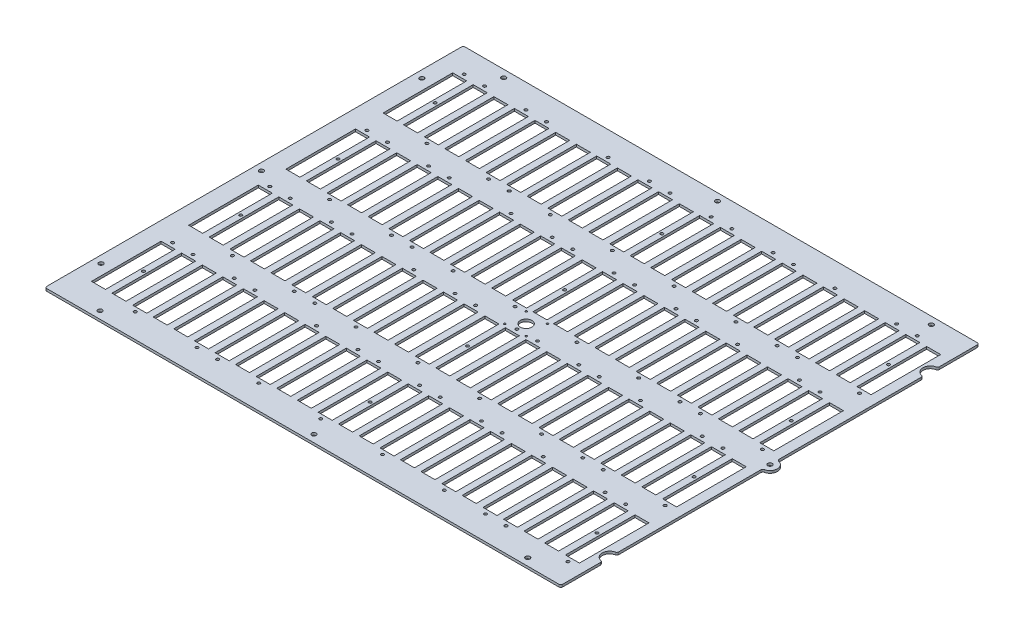
from build123d import *

# Parameters (mm, degrees)
BOSS_EXTRUDE1_DEPTH        = 3.175
SKETCH2_R                  = 1.905
SKETCH2_W                  = 18.288
SKETCH2_H                  = 90.932
CUT_EXTRUDE1_DEPTH         = 3.175
F_1_0_228_DIAMETER_HOLE1_D = 5.7912
FILLET1_R                  = 2.54
CUT_EXTRUDE3_OUTLINE_W     = 18.288
CUT_EXTRUDE3_OUTLINE_H     = 90.932
CUT_EXTRUDE3_OUTLINE_R     = 1.89865
CUT_EXTRUDE3_OUTLINE_R_2   = 2.8956
CUT_EXTRUDE3_OUTLINE_R_3   = 1.905
CUT_EXTRUDE3_DEPTH         = 3.175
CUT_EXTRUDE4_OUTLINE_R     = 1.2192
CUT_EXTRUDE4_OUTLINE_R_2   = 7.62
CUT_EXTRUDE4_DEPTH         = 3.175


# Read off the part's stored shape, not the designer's step: Cut-Extrude3, Cut-Extrude4
with BuildPart() as part:
    # Sketch1 → Boss-Extrude1 (new body)
    with BuildSketch(Plane(origin=(0, 0, 0), x_dir=(1, 0, 0), z_dir=(0, 1, 0))):
        with BuildLine():
            Line((337.058, 219.202), (337.058, 273.304))
            Line((337.058, 273.304), (-337.058, 273.304))
            Line((-337.058, 273.304), (-337.058, -273.304))
            Line((-337.058, -273.304), (337.058, -273.304))
            Line((337.058, -273.304), (337.058, -219.202))
            ThreePointArc((337.058, -219.202), (327.406, -209.55), (337.058, -199.898))
            Line((337.058, -199.898), (337.058, -9.652))
            ThreePointArc((337.058, -9.652), (346.71, 0), (337.058, 9.652))
            Line((337.058, 9.652), (337.058, 199.898))
            ThreePointArc((337.058, 199.898), (327.406, 209.55), (337.058, 219.202))
        make_face()
    extrude(amount=BOSS_EXTRUDE1_DEPTH)

    # Sketch2 → Cut-Extrude1 (cut)
    with BuildSketch(Plane(origin=(0, 3.175, 0), x_dir=(1, 0, 0), z_dir=(0, 1, 0))):
        with Locations(Location((-304.313166667, 241.808, 0), (0, 0, 270))):
            Circle(SKETCH2_R)
        with Locations(Location((-250.465166667, 139.192, 0), (0, 0, 270))):
            Circle(SKETCH2_R)
        with Locations(Location((-169.693166667, 139.192, 0), (0, 0, 270))):
            Circle(SKETCH2_R)
        with Locations(Location((-169.693166667, 12.192, 0), (0, 0, 270))):
            Circle(SKETCH2_R)
        with Locations(Location((-196.7865, 241.808, 0), (0, 0, 270))):
            Circle(SKETCH2_R)
        with Locations(Location((-169.693166667, -114.808, 0), (0, 0, 270))):
            Circle(SKETCH2_R)
        with Locations(Location((-169.693166667, -241.808, 0), (0, 0, 270))):
            Circle(SKETCH2_R)
        with Locations(Location((-116.1415, 241.808, 0), (0, 0, 270))):
            Circle(SKETCH2_R)
        with Locations(Location((-250.465166667, 12.192, 0), (0, 0, 270))):
            Circle(SKETCH2_R)
        with Locations(Location((-250.465166667, -114.808, 0), (0, 0, 270))):
            Circle(SKETCH2_R)
        with Locations(Location((-250.465166667, -241.808, 0), (0, 0, 270))):
            Circle(SKETCH2_R)
        with Locations(Location((-277.5585, 241.808, 0), (0, 0, 270))):
            Circle(SKETCH2_R)
        with Locations(Location((-277.5585, 114.808, 0), (0, 0, 270))):
            Circle(SKETCH2_R)
        with Locations(Location((-277.5585, -12.192, 0), (0, 0, 270))):
            Circle(SKETCH2_R)
        with Locations(Location((-277.5585, -139.192, 0), (0, 0, 270))):
            Circle(SKETCH2_R)
        with Locations(Location((-142.769166667, 139.192, 0), (0, 0, 270))):
            Circle(SKETCH2_R)
        with Locations(Location((-142.769166667, 12.192, 0), (0, 0, 270))):
            Circle(SKETCH2_R)
        with Locations(Location((-142.769166667, -114.808, 0), (0, 0, 270))):
            Circle(SKETCH2_R)
        with Locations(Location((-142.769166667, -241.808, 0), (0, 0, 270))):
            Circle(SKETCH2_R)
        with Locations(Location((-62.2935, 241.808, 0), (0, 0, 270))):
            Circle(SKETCH2_R)
        with Locations(Location((-62.2935, 114.808, 0), (0, 0, 270))):
            Circle(SKETCH2_R)
        with Locations(Location((-62.2935, -12.192, 0), (0, 0, 270))):
            Circle(SKETCH2_R)
        with Locations(Location((-62.2935, -139.192, 0), (0, 0, 270))):
            Circle(SKETCH2_R)
        with Locations(Location((-35.3695, 241.808, 0), (0, 0, 270))):
            Circle(SKETCH2_R)
        with Locations(Location((-35.3695, 114.808, 0), (0, 0, 270))):
            Circle(SKETCH2_R)
        with Locations(Location((-35.3695, -12.192, 0), (0, 0, 270))):
            Circle(SKETCH2_R)
        with Locations(Location((-35.3695, -139.192, 0), (0, 0, 270))):
            Circle(SKETCH2_R)
        with Locations(Location((-196.7865, 114.808, 0), (0, 0, 270))):
            Circle(SKETCH2_R)
        with Locations(Location((-8.149166667, 139.192, 0), (0, 0, 270))):
            Circle(SKETCH2_R)
        with Locations(Location((-8.149166667, 12.192, 0), (0, 0, 270))):
            Circle(SKETCH2_R)
        with Locations(Location((-116.1415, 114.808, 0), (0, 0, 270))):
            Circle(SKETCH2_R)
        with Locations(Location((-8.149166667, -114.808, 0), (0, 0, 270))):
            Circle(SKETCH2_R)
        with Locations(Location((-8.149166667, -241.808, 0), (0, 0, 270))):
            Circle(SKETCH2_R)
        with Locations(Location((18.4785, 241.808, 0), (0, 0, 270))):
            Circle(SKETCH2_R)
        with Locations(Location((18.4785, 114.808, 0), (0, 0, 270))):
            Circle(SKETCH2_R)
        with Locations(Location((18.4785, -12.192, 0), (0, 0, 270))):
            Circle(SKETCH2_R)
        with Locations(Location((18.4785, -139.192, 0), (0, 0, 270))):
            Circle(SKETCH2_R)
        with Locations(Location((45.4025, 241.808, 0), (0, 0, 270))):
            Circle(SKETCH2_R)
        with Locations(Location((45.4025, 114.808, 0), (0, 0, 270))):
            Circle(SKETCH2_R)
        with Locations(Location((45.4025, -12.192, 0), (0, 0, 270))):
            Circle(SKETCH2_R)
        with Locations(Location((45.4025, -139.192, 0), (0, 0, 270))):
            Circle(SKETCH2_R)
        with Locations(Location((126.1745, 241.808, 0), (0, 0, 270))):
            Circle(SKETCH2_R)
        with Locations(Location((126.1745, 114.808, 0), (0, 0, 270))):
            Circle(SKETCH2_R)
        with Locations(Location((126.1745, -12.192, 0), (0, 0, 270))):
            Circle(SKETCH2_R)
        with Locations(Location((126.1745, -139.192, 0), (0, 0, 270))):
            Circle(SKETCH2_R)
        with Locations(Location((180.0225, 241.808, 0), (0, 0, 270))):
            Circle(SKETCH2_R)
        with Locations(Location((180.0225, 114.808, 0), (0, 0, 270))):
            Circle(SKETCH2_R)
        with Locations(Location((180.0225, -12.192, 0), (0, 0, 270))):
            Circle(SKETCH2_R)
        with Locations(Location((180.0225, -139.192, 0), (0, 0, 270))):
            Circle(SKETCH2_R)
        with Locations(Location((260.7945, 241.808, 0), (0, 0, 270))):
            Circle(SKETCH2_R)
        with Locations(Location((-196.7865, -12.192, 0), (0, 0, 270))):
            Circle(SKETCH2_R)
        with Locations(Location((260.7945, 114.808, 0), (0, 0, 270))):
            Circle(SKETCH2_R)
        with Locations(Location((260.7945, -12.192, 0), (0, 0, 270))):
            Circle(SKETCH2_R)
        with Locations(Location((-116.1415, -12.192, 0), (0, 0, 270))):
            Circle(SKETCH2_R)
        with Locations(Location((260.7945, -139.192, 0), (0, 0, 270))):
            Circle(SKETCH2_R)
        with Locations(Location((287.7185, 241.808, 0), (0, 0, 270))):
            Circle(SKETCH2_R)
        with Locations(Location((287.7185, 114.808, 0), (0, 0, 270))):
            Circle(SKETCH2_R)
        with Locations(Location((287.7185, -12.192, 0), (0, 0, 270))):
            Circle(SKETCH2_R)
        with Locations(Location((287.7185, -139.192, 0), (0, 0, 270))):
            Circle(SKETCH2_R)
        with Locations(Location((72.622833333, 139.192, 0), (0, 0, 270))):
            Circle(SKETCH2_R)
        with Locations(Location((72.622833333, 12.192, 0), (0, 0, 270))):
            Circle(SKETCH2_R)
        with Locations(Location((72.622833333, -114.808, 0), (0, 0, 270))):
            Circle(SKETCH2_R)
        with Locations(Location((72.622833333, -241.808, 0), (0, 0, 270))):
            Circle(SKETCH2_R)
        with Locations(Location((153.394833333, 139.192, 0), (0, 0, 270))):
            Circle(SKETCH2_R)
        with Locations(Location((153.394833333, 12.192, 0), (0, 0, 270))):
            Circle(SKETCH2_R)
        with Locations(Location((153.394833333, -114.808, 0), (0, 0, 270))):
            Circle(SKETCH2_R)
        with Locations(Location((153.394833333, -241.808, 0), (0, 0, 270))):
            Circle(SKETCH2_R)
        with Locations(Location((207.242833333, 139.192, 0), (0, 0, 270))):
            Circle(SKETCH2_R)
        with Locations(Location((207.242833333, 12.192, 0), (0, 0, 270))):
            Circle(SKETCH2_R)
        with Locations(Location((207.242833333, -114.808, 0), (0, 0, 270))):
            Circle(SKETCH2_R)
        with Locations(Location((207.242833333, -241.808, 0), (0, 0, 270))):
            Circle(SKETCH2_R)
        with Locations(Location((314.938833333, 139.192, 0), (0, 0, 270))):
            Circle(SKETCH2_R)
        with Locations(Location((314.938833333, 12.192, 0), (0, 0, 270))):
            Circle(SKETCH2_R)
        with Locations(Location((-196.7865, -139.192, 0), (0, 0, 270))):
            Circle(SKETCH2_R)
        with Locations(Location((314.938833333, -114.808, 0), (0, 0, 270))):
            Circle(SKETCH2_R)
        with Locations(Location((314.938833333, -241.808, 0), (0, 0, 270))):
            Circle(SKETCH2_R)
        with Locations(Location((-116.1415, -139.192, 0), (0, 0, 270))):
            Circle(SKETCH2_R)
        with Locations(Location((-304.313166667, 114.808, 0), (0, 0, 270))):
            Circle(SKETCH2_R)
        with Locations(Location((-304.313166667, -12.192, 0), (0, 0, 270))):
            Circle(SKETCH2_R)
        with Locations(Location((-304.313166667, -139.192, 0), (0, 0, 270))):
            Circle(SKETCH2_R)
        with Locations((-250.465166667, 190.5)):
            Rectangle(SKETCH2_W, SKETCH2_H)
        with Locations((-169.693166667, 190.5)):
            Rectangle(SKETCH2_W, SKETCH2_H)
        with Locations((-304.313166667, 190.5)):
            Rectangle(SKETCH2_W, SKETCH2_H)
        with Locations((-169.693166667, 63.5)):
            Rectangle(SKETCH2_W, SKETCH2_H)
        with Locations((-169.693166667, -63.5)):
            Rectangle(SKETCH2_W, SKETCH2_H)
        with Locations((-196.7865, 190.5)):
            Rectangle(SKETCH2_W, SKETCH2_H)
        with Locations((-169.693166667, -190.5)):
            Rectangle(SKETCH2_W, SKETCH2_H)
        with Locations((-250.465166667, 63.5)):
            Rectangle(SKETCH2_W, SKETCH2_H)
        with Locations((-116.1415, 190.5)):
            Rectangle(SKETCH2_W, SKETCH2_H)
        with Locations((-250.465166667, -63.5)):
            Rectangle(SKETCH2_W, SKETCH2_H)
        with Locations((-250.465166667, -190.5)):
            Rectangle(SKETCH2_W, SKETCH2_H)
        with Locations((-277.5585, 190.5)):
            Rectangle(SKETCH2_W, SKETCH2_H)
        with Locations((-277.5585, 63.5)):
            Rectangle(SKETCH2_W, SKETCH2_H)
        with Locations((-277.5585, -63.5)):
            Rectangle(SKETCH2_W, SKETCH2_H)
        with Locations((-277.5585, -190.5)):
            Rectangle(SKETCH2_W, SKETCH2_H)
        with Locations((-142.769166667, 190.5)):
            Rectangle(SKETCH2_W, SKETCH2_H)
        with Locations((-142.769166667, 63.5)):
            Rectangle(SKETCH2_W, SKETCH2_H)
        with Locations((-142.769166667, -63.5)):
            Rectangle(SKETCH2_W, SKETCH2_H)
        with Locations((-142.769166667, -190.5)):
            Rectangle(SKETCH2_W, SKETCH2_H)
        with Locations((-62.2935, 190.5)):
            Rectangle(SKETCH2_W, SKETCH2_H)
        with Locations((-62.2935, 63.5)):
            Rectangle(SKETCH2_W, SKETCH2_H)
        with Locations((-62.2935, -63.5)):
            Rectangle(SKETCH2_W, SKETCH2_H)
        with Locations((-62.2935, -190.5)):
            Rectangle(SKETCH2_W, SKETCH2_H)
        with Locations((-35.3695, 190.5)):
            Rectangle(SKETCH2_W, SKETCH2_H)
        with Locations((-35.3695, 63.5)):
            Rectangle(SKETCH2_W, SKETCH2_H)
        with Locations((-35.3695, -63.5)):
            Rectangle(SKETCH2_W, SKETCH2_H)
        with Locations((-35.3695, -190.5)):
            Rectangle(SKETCH2_W, SKETCH2_H)
        with Locations((-8.149166667, 190.5)):
            Rectangle(SKETCH2_W, SKETCH2_H)
        with Locations((-196.7865, 63.5)):
            Rectangle(SKETCH2_W, SKETCH2_H)
        with Locations((-8.149166667, 63.5)):
            Rectangle(SKETCH2_W, SKETCH2_H)
        with Locations((-8.149166667, -63.5)):
            Rectangle(SKETCH2_W, SKETCH2_H)
        with Locations((-116.1415, 63.5)):
            Rectangle(SKETCH2_W, SKETCH2_H)
        with Locations((-8.149166667, -190.5)):
            Rectangle(SKETCH2_W, SKETCH2_H)
        with Locations((18.4785, 190.5)):
            Rectangle(SKETCH2_W, SKETCH2_H)
        with Locations((18.4785, 63.5)):
            Rectangle(SKETCH2_W, SKETCH2_H)
        with Locations((18.4785, -63.5)):
            Rectangle(SKETCH2_W, SKETCH2_H)
        with Locations((18.4785, -190.5)):
            Rectangle(SKETCH2_W, SKETCH2_H)
        with Locations((45.4025, 190.5)):
            Rectangle(SKETCH2_W, SKETCH2_H)
        with Locations((45.4025, 63.5)):
            Rectangle(SKETCH2_W, SKETCH2_H)
        with Locations((45.4025, -63.5)):
            Rectangle(SKETCH2_W, SKETCH2_H)
        with Locations((45.4025, -190.5)):
            Rectangle(SKETCH2_W, SKETCH2_H)
        with Locations((126.1745, 190.5)):
            Rectangle(SKETCH2_W, SKETCH2_H)
        with Locations((126.1745, 63.5)):
            Rectangle(SKETCH2_W, SKETCH2_H)
        with Locations((126.1745, -63.5)):
            Rectangle(SKETCH2_W, SKETCH2_H)
        with Locations((126.1745, -190.5)):
            Rectangle(SKETCH2_W, SKETCH2_H)
        with Locations((180.0225, 190.5)):
            Rectangle(SKETCH2_W, SKETCH2_H)
        with Locations((180.0225, 63.5)):
            Rectangle(SKETCH2_W, SKETCH2_H)
        with Locations((180.0225, -63.5)):
            Rectangle(SKETCH2_W, SKETCH2_H)
        with Locations((180.0225, -190.5)):
            Rectangle(SKETCH2_W, SKETCH2_H)
        with Locations((260.7945, 190.5)):
            Rectangle(SKETCH2_W, SKETCH2_H)
        with Locations((260.7945, 63.5)):
            Rectangle(SKETCH2_W, SKETCH2_H)
        with Locations((-196.7865, -63.5)):
            Rectangle(SKETCH2_W, SKETCH2_H)
        with Locations((260.7945, -63.5)):
            Rectangle(SKETCH2_W, SKETCH2_H)
        with Locations((260.7945, -190.5)):
            Rectangle(SKETCH2_W, SKETCH2_H)
        with Locations((-116.1415, -63.5)):
            Rectangle(SKETCH2_W, SKETCH2_H)
        with Locations((287.7185, 190.5)):
            Rectangle(SKETCH2_W, SKETCH2_H)
        with Locations((287.7185, 63.5)):
            Rectangle(SKETCH2_W, SKETCH2_H)
        with Locations((287.7185, -63.5)):
            Rectangle(SKETCH2_W, SKETCH2_H)
        with Locations((287.7185, -190.5)):
            Rectangle(SKETCH2_W, SKETCH2_H)
        with Locations((72.622833333, 190.5)):
            Rectangle(SKETCH2_W, SKETCH2_H)
        with Locations((72.622833333, 63.5)):
            Rectangle(SKETCH2_W, SKETCH2_H)
        with Locations((72.622833333, -63.5)):
            Rectangle(SKETCH2_W, SKETCH2_H)
        with Locations((72.622833333, -190.5)):
            Rectangle(SKETCH2_W, SKETCH2_H)
        with Locations((153.394833333, 190.5)):
            Rectangle(SKETCH2_W, SKETCH2_H)
        with Locations((153.394833333, 63.5)):
            Rectangle(SKETCH2_W, SKETCH2_H)
        with Locations((153.394833333, -63.5)):
            Rectangle(SKETCH2_W, SKETCH2_H)
        with Locations((153.394833333, -190.5)):
            Rectangle(SKETCH2_W, SKETCH2_H)
        with Locations((207.242833333, 190.5)):
            Rectangle(SKETCH2_W, SKETCH2_H)
        with Locations((207.242833333, 63.5)):
            Rectangle(SKETCH2_W, SKETCH2_H)
        with Locations((207.242833333, -63.5)):
            Rectangle(SKETCH2_W, SKETCH2_H)
        with Locations((207.242833333, -190.5)):
            Rectangle(SKETCH2_W, SKETCH2_H)
        with Locations((314.938833333, 190.5)):
            Rectangle(SKETCH2_W, SKETCH2_H)
        with Locations((314.938833333, 63.5)):
            Rectangle(SKETCH2_W, SKETCH2_H)
        with Locations((-196.7865, -190.5)):
            Rectangle(SKETCH2_W, SKETCH2_H)
        with Locations((314.938833333, -63.5)):
            Rectangle(SKETCH2_W, SKETCH2_H)
        with Locations((314.938833333, -190.5)):
            Rectangle(SKETCH2_W, SKETCH2_H)
        with Locations((-116.1415, -190.5)):
            Rectangle(SKETCH2_W, SKETCH2_H)
        with Locations((-304.313166667, 63.5)):
            Rectangle(SKETCH2_W, SKETCH2_H)
        with Locations((-304.313166667, -63.5)):
            Rectangle(SKETCH2_W, SKETCH2_H)
        with Locations((-304.313166667, -190.5)):
            Rectangle(SKETCH2_W, SKETCH2_H)
    extrude(amount=-CUT_EXTRUDE1_DEPTH, mode=Mode.SUBTRACT)

    # #1 (0.228) Diameter Hole1 (through all)
    with Locations(Plane(origin=(0, 3.175, 0), x_dir=(1, 0, 0), z_dir=(0, 1, 0))):
        with Locations((337.058, 0)):
            Hole(F_1_0_228_DIAMETER_HOLE1_D / 2)

    # Fillet1
    fillet1_edges = [part.edges().sort_by_distance(p)[0] for p in [
        (337.058, 1.5875, -273.304),
        (337.058, 1.5875, -219.202),
        (337.058, 1.5875, -199.898),
        (337.058, 1.5875, -9.652),
        (337.058, 1.5875, 9.652),
        (337.058, 1.5875, 199.898),
        (337.058, 1.5875, 219.202),
        (337.058, 1.5875, 273.304),
        (-337.058, 1.5875, 273.304),
        (-337.058, 1.5875, -273.304),
    ]]
    fillet(fillet1_edges, radius=FILLET1_R)

    # Cut-Extrude3 outline → Cut-Extrude3 (cut)
    with BuildSketch(Plane(origin=(0, 0, 0), x_dir=(1, 0, 0), z_dir=(0, 1, 0))):
        with Locations((233.9975, 190.5)):
            Rectangle(CUT_EXTRUDE3_OUTLINE_W, CUT_EXTRUDE3_OUTLINE_H)
        with Locations((99.3775, 190.5)):
            Rectangle(CUT_EXTRUDE3_OUTLINE_W, CUT_EXTRUDE3_OUTLINE_H)
        with Locations((-223.7105, 190.5)):
            Rectangle(CUT_EXTRUDE3_OUTLINE_W, CUT_EXTRUDE3_OUTLINE_H)
        with Locations((-89.0905, 190.5)):
            Rectangle(CUT_EXTRUDE3_OUTLINE_W, CUT_EXTRUDE3_OUTLINE_H)
        with Locations((-223.7105, -190.5)):
            Rectangle(CUT_EXTRUDE3_OUTLINE_W, CUT_EXTRUDE3_OUTLINE_H)
        with Locations((-89.0905, -190.5)):
            Rectangle(CUT_EXTRUDE3_OUTLINE_W, CUT_EXTRUDE3_OUTLINE_H)
        with Locations((233.9975, -190.5)):
            Rectangle(CUT_EXTRUDE3_OUTLINE_W, CUT_EXTRUDE3_OUTLINE_H)
        with Locations((99.3775, -190.5)):
            Rectangle(CUT_EXTRUDE3_OUTLINE_W, CUT_EXTRUDE3_OUTLINE_H)
        with Locations((-223.7105, -63.5)):
            Rectangle(CUT_EXTRUDE3_OUTLINE_W, CUT_EXTRUDE3_OUTLINE_H)
        with Locations((-89.0905, -63.5)):
            Rectangle(CUT_EXTRUDE3_OUTLINE_W, CUT_EXTRUDE3_OUTLINE_H)
        with Locations((233.9975, -63.5)):
            Rectangle(CUT_EXTRUDE3_OUTLINE_W, CUT_EXTRUDE3_OUTLINE_H)
        with Locations((99.3775, -63.5)):
            Rectangle(CUT_EXTRUDE3_OUTLINE_W, CUT_EXTRUDE3_OUTLINE_H)
        with Locations((233.9975, 63.5)):
            Rectangle(CUT_EXTRUDE3_OUTLINE_W, CUT_EXTRUDE3_OUTLINE_H)
        with Locations((-89.0905, 63.5)):
            Rectangle(CUT_EXTRUDE3_OUTLINE_W, CUT_EXTRUDE3_OUTLINE_H)
        with Locations((-223.7105, 63.5)):
            Rectangle(CUT_EXTRUDE3_OUTLINE_W, CUT_EXTRUDE3_OUTLINE_H)
        with Locations((99.3775, 63.5)):
            Rectangle(CUT_EXTRUDE3_OUTLINE_W, CUT_EXTRUDE3_OUTLINE_H)
        with Locations((-290.935833333, -190.5)):
            Circle(CUT_EXTRUDE3_OUTLINE_R)
        with Locations((-290.935833333, -63.5)):
            Circle(CUT_EXTRUDE3_OUTLINE_R)
        with Locations((-290.935833333, 63.5)):
            Circle(CUT_EXTRUDE3_OUTLINE_R)
        with Locations((301.392166667, -190.5)):
            Circle(CUT_EXTRUDE3_OUTLINE_R)
        with Locations((5.228166667, -190.5)):
            Circle(CUT_EXTRUDE3_OUTLINE_R)
        with Locations((301.392166667, -63.5)):
            Circle(CUT_EXTRUDE3_OUTLINE_R)
        with Locations((5.228166667, -63.5)):
            Circle(CUT_EXTRUDE3_OUTLINE_R)
        with Locations((301.392166667, 63.5)):
            Circle(CUT_EXTRUDE3_OUTLINE_R)
        with Locations((5.228166667, 63.5)):
            Circle(CUT_EXTRUDE3_OUTLINE_R)
        with Locations((301.392166667, 190.5)):
            Circle(CUT_EXTRUDE3_OUTLINE_R)
        with Locations((5.228166667, 190.5)):
            Circle(CUT_EXTRUDE3_OUTLINE_R)
        with Locations((-290.935833333, 190.5)):
            Circle(CUT_EXTRUDE3_OUTLINE_R)
        with Locations((4.826, 263.652)):
            Circle(CUT_EXTRUDE3_OUTLINE_R_2)
        with Locations((-274.574, 263.652)):
            Circle(CUT_EXTRUDE3_OUTLINE_R_2)
        with Locations((-327.406, 209.55)):
            Circle(CUT_EXTRUDE3_OUTLINE_R_2)
        with Locations((-327.406, 0)):
            Circle(CUT_EXTRUDE3_OUTLINE_R_2)
        with Locations((-327.406, -209.55)):
            Circle(CUT_EXTRUDE3_OUTLINE_R_2)
        with Locations((-274.574, -263.652)):
            Circle(CUT_EXTRUDE3_OUTLINE_R_2)
        with Locations((4.826, -263.652)):
            Circle(CUT_EXTRUDE3_OUTLINE_R_2)
        with Locations((284.226, -263.652)):
            Circle(CUT_EXTRUDE3_OUTLINE_R_2)
        with Locations((284.226, 263.652)):
            Circle(CUT_EXTRUDE3_OUTLINE_R_2)
        with Locations((-223.7105, -12.192)):
            Circle(CUT_EXTRUDE3_OUTLINE_R_3)
        with Locations((-223.7105, 114.808)):
            Circle(CUT_EXTRUDE3_OUTLINE_R_3)
        with Locations((99.3775, 241.808)):
            Circle(CUT_EXTRUDE3_OUTLINE_R_3)
        with Locations((-223.7105, -139.192)):
            Circle(CUT_EXTRUDE3_OUTLINE_R_3)
        with Locations((-223.7105, 241.808)):
            Circle(CUT_EXTRUDE3_OUTLINE_R_3)
        with Locations((-89.0905, 139.192)):
            Circle(CUT_EXTRUDE3_OUTLINE_R_3)
        with Locations((233.9975, 139.192)):
            Circle(CUT_EXTRUDE3_OUTLINE_R_3)
        with Locations((233.9975, 12.192)):
            Circle(CUT_EXTRUDE3_OUTLINE_R_3)
        with Locations((233.9975, -114.808)):
            Circle(CUT_EXTRUDE3_OUTLINE_R_3)
        with Locations((-89.0905, -241.808)):
            Circle(CUT_EXTRUDE3_OUTLINE_R_3)
        with Locations((-89.0905, -114.808)):
            Circle(CUT_EXTRUDE3_OUTLINE_R_3)
        with Locations((-89.0905, 12.192)):
            Circle(CUT_EXTRUDE3_OUTLINE_R_3)
        with Locations((233.9975, -241.808)):
            Circle(CUT_EXTRUDE3_OUTLINE_R_3)
        with Locations((99.3775, 114.808)):
            Circle(CUT_EXTRUDE3_OUTLINE_R_3)
        with Locations((99.3775, -12.192)):
            Circle(CUT_EXTRUDE3_OUTLINE_R_3)
        with Locations((99.3775, -139.192)):
            Circle(CUT_EXTRUDE3_OUTLINE_R_3)
    extrude(amount=CUT_EXTRUDE3_DEPTH, mode=Mode.SUBTRACT)

    # Cut-Extrude4 outline → Cut-Extrude4 (cut)
    with BuildSketch(Plane(origin=(0, 0, 0), x_dir=(1, 0, 0), z_dir=(0, 1, 0))):
        with Locations((32.4485, -13.97)):
            Circle(CUT_EXTRUDE4_OUTLINE_R)
        with Locations((4.5085, 13.97)):
            Circle(CUT_EXTRUDE4_OUTLINE_R)
        with Locations((4.5085, -13.97)):
            Circle(CUT_EXTRUDE4_OUTLINE_R)
        with Locations((32.4485, 13.97)):
            Circle(CUT_EXTRUDE4_OUTLINE_R)
        with Locations((18.4785, 0)):
            Circle(CUT_EXTRUDE4_OUTLINE_R_2)
    extrude(amount=CUT_EXTRUDE4_DEPTH, mode=Mode.SUBTRACT)


solid = part.part
